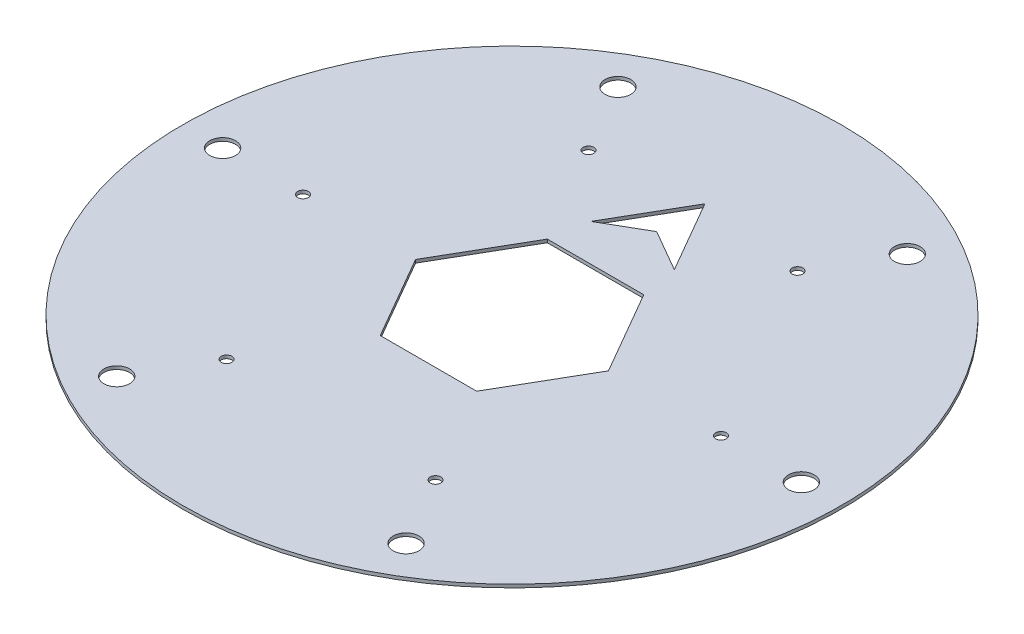
from build123d import *

# Parameters (mm, degrees)
SKETCH_1_R               = 102.5
SM_BASE_FLANGE_1_DEPTH   = 1
HOLE_WIZARD_8_0_8_1_D    = 8
PATTERN_CIRCULAR_1_COUNT = 6
HOLE_WIZARD_3_3_3_3_1_D  = 3.3


# Sheet-metal steps are written as plain solids
with BuildPart() as part:
    # Sketch 1 → 基体-法兰1 (new body)
    with BuildSketch(Plane(origin=(0, 0, 0), x_dir=(1, 0, 0), z_dir=(0, 1, 0))):
        with Locations(Location((0, 0, 0), (0, 0, 270))):
            Circle(SKETCH_1_R)
        Polygon((-12.990381057, 37.5), (0, 60), (12.990381057, 37.5), (0, 45), align=None, mode=Mode.SUBTRACT)
        Polygon((30, 0), (15, 25.980762114), (-15, 25.980762114), (-30, 0), (-15, -25.980762114), (15, -25.980762114), align=None, mode=Mode.SUBTRACT)
    extrude(amount=-SM_BASE_FLANGE_1_DEPTH)

    # Ø8.0 (8) 直径孔1 (through all)
    with Locations(Plane(origin=(0, 0, 0), x_dir=(1, 0, 0), z_dir=(0, 1, 0))):
        with Locations((-90, 0)):
            hole_wizard_8_0_8_1 = Hole(HOLE_WIZARD_8_0_8_1_D / 2)

    # 阵列(圆周)1: Ø8.0 (8) 直径孔1 ×6 about axis
    pattern_circular_1_axis = Axis((0, 0, 0), (0, 1, 0))
    for i in range(1, PATTERN_CIRCULAR_1_COUNT):
        add(hole_wizard_8_0_8_1.rotate(pattern_circular_1_axis, i * 360 / PATTERN_CIRCULAR_1_COUNT), mode=Mode.SUBTRACT)

    # Ø3.3 (3.3) 直径孔1 (through all)
    with Locations(Plane(origin=(0, 0, 0), x_dir=(1, 0, 0), z_dir=(0, 1, 0))):
        with Locations((32.5, -56.291651246), (65, 0), (32.5, 56.291651246), (-32.5, 56.291651246), (-65, 0), (-32.5, -56.291651246)):
            Hole(HOLE_WIZARD_3_3_3_3_1_D / 2)


solid = part.part
